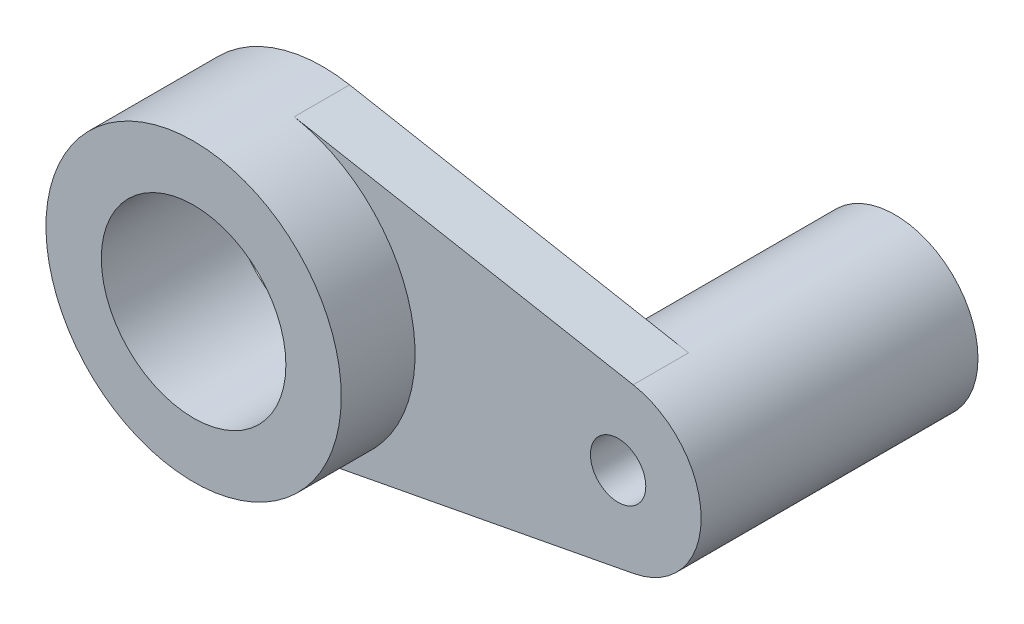
from build123d import *

# Parameters (mm, degrees)
CROQUIS1_R              = 16
CROQUIS1_R_2            = 10
SALIENTE_EXTRUIR1_DEPTH = 14
CROQUIS1_3_R            = 3
SALIENTE_EXTRUIR2_DEPTH = 6
SALIENTE_EXTRUIR3_START = -24
CROQUIS1_4_R            = 3
SALIENTE_EXTRUIR3_DEPTH = 24


with BuildPart() as part:
    # Croquis1 → Saliente-Extruir1 (new body)
    with BuildSketch(Plane.XY):
        with Locations((-55.240158469, 16.592403897)):
            Circle(CROQUIS1_R)
        with Locations((-55.240158469, 16.592403897)):
            Circle(CROQUIS1_R_2, mode=Mode.SUBTRACT)
    extrude(amount=SALIENTE_EXTRUIR1_DEPTH)

    # Croquis1<3> → Saliente-Extruir2 (add)
    with BuildSketch(Plane.XY):
        with BuildLine():
            Line((-15.605986, 25.544072611), (-52.334722933, 32.326393993))
            ThreePointArc((-52.334722933, 32.326393993), (-39.240215319, 16.635056228), (-52.250878107, 0.874127817))
            Line((-52.250878107, 0.874127817), (-15.558823286, 7.852172887))
            ThreePointArc((-15.558823286, 7.852172887), (-8.240325468, 16.717695118), (-15.605986, 25.544072611))
        make_face()
        with Locations((-17.240293489, 16.693703182)):
            Circle(CROQUIS1_3_R, mode=Mode.SUBTRACT)
    extrude(amount=SALIENTE_EXTRUIR2_DEPTH)

    # Croquis1<4> → Saliente-Extruir3 (add)
    with BuildSketch(Plane.XY.offset(SALIENTE_EXTRUIR3_START)):
        with BuildLine():
            ThreePointArc((-8.240293489, 16.693703182), (-10.322607192, 22.45092615), (-15.605986, 25.544072611))
            ThreePointArc((-15.605986, 25.544072611), (-26.240261511, 16.669711246), (-15.558823286, 7.852172887))
            ThreePointArc((-15.558823286, 7.852172887), (-10.307284336, 10.954941636), (-8.240293489, 16.693703182))
        make_face()
        with Locations((-17.240293489, 16.693703182)):
            Circle(CROQUIS1_4_R, mode=Mode.SUBTRACT)
    extrude(amount=SALIENTE_EXTRUIR3_DEPTH)


solid = part.part
